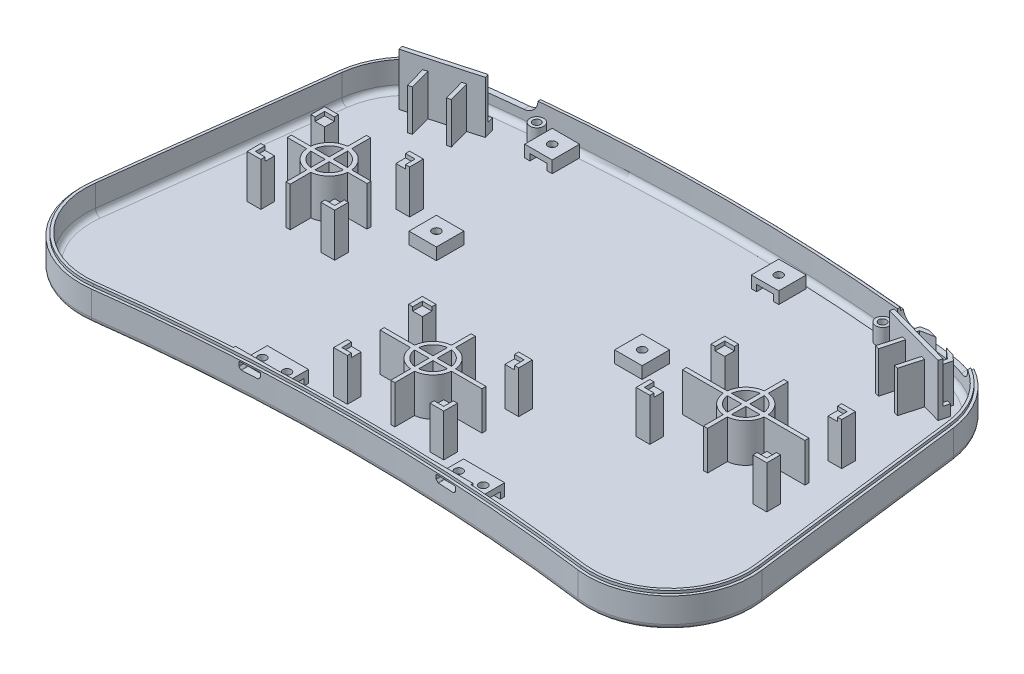
from build123d import *

# Parameters (mm, degrees)
FOND_COQUE_DEPTH               = 2
CONTOUR_COQUE_DEPTH            = 10
CONG_1_R                       = 2
CONG_2_R                       = 2
GLISSI_RES_ARDUINO_DUE_DEPTH   = 2.35
ESQUISSE_SUPPORT_ARDUINO_DUE_W = 10
ESQUISSE_SUPPORT_ARDUINO_DUE_H = 10
ESQUISSE_SUPPORT_ARDUINO_DUE_R = 1.5
SUPPORT_ARDUINO_DUE_DEPTH      = 2
ENTR_E_USB_NATIVE_REACH        = 144.927
GLISSI_RES_USB_NATIVE_DEPTH    = 2.35
ESQUISSE_SUPPORT_USB_NATIVE_R  = 1.5
SUPPORT_USB_NATIVE_DEPTH       = 2.05
BOSS_EXTRU_4_DEPTH             = 5.6
COINS_DPAD_DEPTH               = 15.8
ESQUISSE_INT_RIEUR_DPAD_W      = 3.5
ESQUISSE_INT_RIEUR_DPAD_H      = 3.5
INT_RIEUR_DPAD_DEPTH           = 14.4
ESQUISSE_CERCLE_DPAD_R         = 7.5
ESQUISSE_CERCLE_DPAD_R_2       = 6
CERCLE_DPAD_DEPTH              = 14.4
COINS_ABXY_DEPTH               = 15.5
ESQUISSE_INT_RIEUR_ABXY_W      = 3.5
ESQUISSE_INT_RIEUR_ABXY_H      = 3.5
INT_RIEUR_ABXY_DEPTH           = 14.1
ESQUISSE_CERCLE_ABXY_R         = 7.5
ESQUISSE_CERCLE_ABXY_R_2       = 6
CERCLE_ABXY_DEPTH              = 14.1
BOSS_EXTRU_1_DEPTH             = 15.4
ESQUISSE2_W                    = 3.5
ESQUISSE2_H                    = 3.5
BOSS_EXTRU_2_DEPTH             = 14
ESQUISSE3_R                    = 7.5
ESQUISSE3_R_2                  = 6
BOSS_EXTRU_3_DEPTH             = 14
ENL_V_MAT_EXTRU_1_DEPTH        = 1
ENL_V_MAT_EXTRU_2_REACH        = 145.53
BOSS_EXTRU_10_DEPTH            = 2.35
ESQUISSE12_R                   = 1.5
BOSS_EXTRU_11_DEPTH            = 2.05
BOSS_EXTRU_12_DEPTH            = 5.6
ENL_V_MAT_EXTRU_3_DEPTH        = 1
ENL_V_MAT_EXTRU_5_DEPTH        = 12.5
ESQUISSE25_R                   = 2.5
ESQUISSE25_R_2                 = 1.4
BOSS_EXTRU_19_DEPTH            = 6.04
BOSS_EXTRU_20_DEPTH            = 14
BOSS_EXTRU_21_DEPTH            = 3.85
BOSS_EXTRU_22_DEPTH            = 4
BOSS_EXTRU_23_DEPTH            = 15
BOSS_EXTRU_24_DEPTH            = 15
BOSS_EXTRU_25_DEPTH            = 1
ENL_V_START                    = -1
ENL_V_MAT_EXTRU_6_DEPTH        = 1


with BuildPart() as part:
    # Esquisse fond coque → Fond coque (new body)
    with BuildSketch(Plane(origin=(0, 0, 0), x_dir=(1, 0, 0), z_dir=(0, 1, 0))):
        with BuildLine():
            Line((-122.267092617, -38.917464466), (-112.267092617, 40.866153364))
            ThreePointArc((-112.267092617, 40.866153364), (-103.730176239, 58.331392363), (-86.278625954, 66.896257055))
            ThreePointArc((-86.278625954, 66.896257055), (0, 72.351557493), (86.278625954, 66.896257055))
            ThreePointArc((86.278625954, 66.896257055), (103.730176239, 58.331392363), (112.267092617, 40.866153364))
            Line((112.267092617, 40.866153364), (122.267092617, -38.917464466))
            ThreePointArc((122.267092617, -38.917464466), (113.659620701, -63.915093672), (88.618881119, -72.396331781))
            ThreePointArc((88.618881119, -72.396331781), (0, -66.639803527), (-88.618881119, -72.396331781))
            ThreePointArc((-88.618881119, -72.396331781), (-113.659620701, -63.915093672), (-122.267092617, -38.917464466))
        make_face()
    extrude(amount=FOND_COQUE_DEPTH)

    # Esquisse contour coque → Contour coque (add)
    with BuildSketch(Plane(origin=(0, 2, 0), x_dir=(1, 0, 0), z_dir=(0, 1, 0))):
        with BuildLine():
            Line((-122.267092617, -38.917464466), (-112.267092617, 40.866153364))
            ThreePointArc((-112.267092617, 40.866153364), (-103.730176239, 58.331392363), (-86.278625954, 66.896257055))
            ThreePointArc((-86.278625954, 66.896257055), (0, 72.351557493), (86.278625954, 66.896257055))
            ThreePointArc((86.278625954, 66.896257055), (103.730176239, 58.331392363), (112.267092617, 40.866153364))
            Line((112.267092617, 40.866153364), (122.267092617, -38.917464466))
            ThreePointArc((122.267092617, -38.917464466), (113.659620701, -63.915093672), (88.618881119, -72.396331781))
            ThreePointArc((88.618881119, -72.396331781), (0, -66.639803527), (-88.618881119, -72.396331781))
            ThreePointArc((-88.618881119, -72.396331781), (-113.659620701, -63.915093672), (-122.267092617, -38.917464466))
        make_face()
        with BuildLine():
            Line((-120.282619776, -39.166196336), (-110.282619776, 40.617421494))
            ThreePointArc((-110.282619776, 40.617421494), (-102.314831157, 56.918311227), (-86.026717557, 64.91218494))
            ThreePointArc((-86.026717557, 64.91218494), (0, 70.351557493), (86.026717557, 64.91218494))
            ThreePointArc((86.026717557, 64.91218494), (102.314831157, 56.918311227), (110.282619776, 40.617421494))
            Line((110.282619776, 40.617421494), (120.282619776, -39.166196336))
            ThreePointArc((120.282619776, -39.166196336), (112.248979321, -62.497316928), (88.877622378, -70.413139163))
            ThreePointArc((88.877622378, -70.413139163), (0, -64.639803527), (-88.877622378, -70.413139163))
            ThreePointArc((-88.877622378, -70.413139163), (-112.248979321, -62.497316928), (-120.282619776, -39.166196336))
        make_face(mode=Mode.SUBTRACT)
    extrude(amount=CONTOUR_COQUE_DEPTH)

    # Congé1
    cong_1_edges = [part.edges().sort_by_distance(p)[0] for p in [
        (-115.282619776, 2, -0.725612579),
        (-102.314831157, 2, -56.918311227),
        (0, 2, -70.351557493),
        (102.314831157, 2, -56.918311227),
        (115.282619776, 2, -0.725612579),
        (112.248979321, 2, 62.497316928),
        (0, 2, 64.639803527),
        (-112.248979321, 2, 62.497316928),
    ]]
    fillet(cong_1_edges, radius=CONG_1_R)

    # Congé2
    cong_2_edges = [part.edges().sort_by_distance(p)[0] for p in [
        (0, 0, 66.639803527),
        (113.659620701, 0, 63.915093672),
        (117.267092617, 0, -0.974344449),
        (103.730176239, 0, -58.331392363),
        (0, 0, -72.351557493),
        (-103.730176239, 0, -58.331392363),
        (-117.267092617, 0, -0.974344449),
        (-113.659620701, 0, 63.915093672),
    ]]
    fillet(cong_2_edges, radius=CONG_2_R)

    # Esquisse glissières Arduino Due → Glissières Arduino Due (add)
    with BuildSketch(Plane(origin=(0, 2, 0), x_dir=(1, 0, 0), z_dir=(0, 1, 0))):
        Polygon((23.198146935, 13.360196473), (24.748146935, 10.675517722), (27.848146935, 10.675517722), (29.398146935, 13.360196473), (29.398146935, 18.360196473), (31.298146935, 18.360196473), (31.298146935, 8.360196473), (21.298146935, 8.360196473), (21.298146935, 18.360196473), (23.198146935, 18.360196473), align=None)
        Polygon((-51.731853065, 13.360196473), (-50.181853065, 10.675517722), (-47.081853065, 10.675517722), (-45.531853065, 13.360196473), (-45.531853065, 18.360196473), (-43.631853065, 18.360196473), (-43.631853065, 8.360196473), (-53.631853065, 8.360196473), (-53.631853065, 18.360196473), (-51.731853065, 18.360196473), align=None)
        Polygon((-51.881853065, 61.880196473), (-53.431853065, 64.564875225), (-56.531853065, 64.564875225), (-58.081853065, 61.880196473), (-58.081853065, 56.880196473), (-59.981853065, 56.880196473), (-59.981853065, 66.880196473), (-49.981853065, 66.880196473), (-49.981853065, 56.880196473), (-51.881853065, 56.880196473), align=None)
        Polygon((30.668146935, 61.880196473), (29.118146935, 64.564875225), (26.018146935, 64.564875225), (24.468146935, 61.880196473), (24.468146935, 56.880196473), (22.568146935, 56.880196473), (22.568146935, 66.880196473), (32.568146935, 66.880196473), (32.568146935, 56.880196473), (30.668146935, 56.880196473), align=None)
    extrude(amount=GLISSI_RES_ARDUINO_DUE_DEPTH)

    # Esquisse support Arduino Due → Support Arduino Due (add)
    # profile 1 of 4: a face of its own
    with BuildSketch(Plane(origin=(0, 4.35, 0), x_dir=(1, 0, 0), z_dir=(0, 1, 0))):
        with Locations((-54.981853065, 61.880196473)):
            Rectangle(ESQUISSE_SUPPORT_ARDUINO_DUE_W, ESQUISSE_SUPPORT_ARDUINO_DUE_H)
        with Locations((-54.981853065, 61.880196473)):
            Circle(ESQUISSE_SUPPORT_ARDUINO_DUE_R, mode=Mode.SUBTRACT)
    # profile 2 of 4: a face of its own
    with BuildSketch(Plane(origin=(0, 4.35, 0), x_dir=(1, 0, 0), z_dir=(0, 1, 0))):
        with Locations((27.568146935, 61.880196473)):
            Rectangle(ESQUISSE_SUPPORT_ARDUINO_DUE_W, ESQUISSE_SUPPORT_ARDUINO_DUE_H)
        with Locations((27.568146935, 61.880196473)):
            Circle(ESQUISSE_SUPPORT_ARDUINO_DUE_R, mode=Mode.SUBTRACT)
    # profile 3 of 4: a face of its own
    with BuildSketch(Plane(origin=(0, 4.35, 0), x_dir=(1, 0, 0), z_dir=(0, 1, 0))):
        with Locations((26.298146935, 13.360196473)):
            Rectangle(ESQUISSE_SUPPORT_ARDUINO_DUE_W, ESQUISSE_SUPPORT_ARDUINO_DUE_H)
        with Locations((26.298146935, 13.360196473)):
            Circle(ESQUISSE_SUPPORT_ARDUINO_DUE_R, mode=Mode.SUBTRACT)
    # profile 4 of 4: a face of its own
    with BuildSketch(Plane(origin=(0, 4.35, 0), x_dir=(1, 0, 0), z_dir=(0, 1, 0))):
        with Locations((-48.631853065, 13.360196473)):
            Rectangle(ESQUISSE_SUPPORT_ARDUINO_DUE_W, ESQUISSE_SUPPORT_ARDUINO_DUE_H)
        with Locations((-48.631853065, 13.360196473)):
            Circle(ESQUISSE_SUPPORT_ARDUINO_DUE_R, mode=Mode.SUBTRACT)
    extrude(amount=SUPPORT_ARDUINO_DUE_DEPTH)

    # Esquisse entrée USB Native → Entrée USB Native (cut, up to next)
    with BuildSketch(Plane.XY, mode=Mode.PRIVATE) as entr_e_usb_native_sk1:
        with BuildLine():
            Line((32.925, 8), (38.575, 8))
            ThreePointArc((38.575, 8), (38.689248248, 8.022606168), (38.786278395, 8.087017747))
            Line((38.786278395, 8.087017747), (39.411278395, 8.707017747))
            ThreePointArc((39.411278395, 8.707017747), (39.47693277, 8.804638651), (39.5, 8.92))
            Line((39.5, 8.92), (39.5, 10.15))
            ThreePointArc((39.5, 10.15), (39.412132034, 10.362132034), (39.2, 10.45))
            Line((39.2, 10.45), (32.3, 10.45))
            ThreePointArc((32.3, 10.45), (32.087867966, 10.362132034), (32, 10.15))
            Line((32, 10.15), (32, 8.92))
            ThreePointArc((32, 8.92), (32.02306723, 8.804638651), (32.088721605, 8.707017747))
            Line((32.088721605, 8.707017747), (32.713721605, 8.087017747))
            ThreePointArc((32.713721605, 8.087017747), (32.810751752, 8.022606168), (32.925, 8))
        make_face()
    entr_e_usb_native_tool1 = extrude(entr_e_usb_native_sk1.sketch, amount=ENTR_E_USB_NATIVE_REACH, mode=Mode.PRIVATE) & part.part
    add(entr_e_usb_native_tool1.solids().sort_by_distance((35.75, 9.2574, 0))[0], mode=Mode.SUBTRACT)

    # Esquisse glissières USB Native → Glissières USB Native (add)
    with BuildSketch(Plane(origin=(0, 2, 0), x_dir=(1, 0, 0), z_dir=(0, 1, 0))):
        with BuildLine():
            Line((28.250303077, -53.642573438), (28.250303077, -55.240893257))
            Line((28.250303077, -55.240893257), (31.175303077, -55.240893257))
            Line((31.175303077, -55.240893257), (33.859981829, -56.790893257))
            Line((33.859981829, -56.790893257), (33.859981829, -59.890893257))
            Line((33.859981829, -59.890893257), (31.175303077, -61.440893257))
            Line((31.175303077, -61.440893257), (28.250303077, -61.440893257))
            Line((28.250303077, -61.440893257), (28.250303077, -65.220893257))
            ThreePointArc((28.250303077, -65.220893257), (35.752439442, -65.570737708), (43.250303077, -66.002573438))
            Line((43.250303077, -66.002573438), (43.250303077, -61.440893257))
            Line((43.250303077, -61.440893257), (40.125303077, -61.440893257))
            Line((40.125303077, -61.440893257), (37.440624325, -59.890893257))
            Line((37.440624325, -59.890893257), (37.440624325, -56.790893257))
            Line((37.440624325, -56.790893257), (40.125303077, -55.240893257))
            Line((40.125303077, -55.240893257), (43.250303077, -55.240893257))
            Line((43.250303077, -55.240893257), (43.250303077, -53.642573438))
            Line((43.250303077, -53.642573438), (28.250303077, -53.642573438))
        make_face()
    extrude(amount=GLISSI_RES_USB_NATIVE_DEPTH)

    # Esquisse support USB Native → Support USB Native (add)
    with BuildSketch(Plane(origin=(0, 4.35, 0), x_dir=(1, 0, 0), z_dir=(0, 1, 0))):
        with BuildLine():
            Line((28.250303077, -53.642573438), (43.250303077, -53.642573438))
            Line((43.250303077, -53.642573438), (43.250303077, -66.002573438))
            ThreePointArc((43.250303077, -66.002573438), (35.752439442, -65.570737708), (28.250303077, -65.220893257))
            Line((28.250303077, -65.220893257), (28.250303077, -53.642573438))
        make_face()
        with Locations((31.175303077, -58.340893257)):
            Circle(ESQUISSE_SUPPORT_USB_NATIVE_R, mode=Mode.SUBTRACT)
        with Locations((40.125303077, -58.340893257)):
            Circle(ESQUISSE_SUPPORT_USB_NATIVE_R, mode=Mode.SUBTRACT)
    extrude(amount=SUPPORT_USB_NATIVE_DEPTH)

    # Esquisse4 → Boss.-Extru.4 (add)
    with BuildSketch(Plane(origin=(0, 6.4, 0), x_dir=(1, 0, 0), z_dir=(0, 1, 0))):
        with BuildLine():
            Line((28.250303077, -65.220893257), (43.250303077, -65.220893257))
            Line((43.250303077, -65.220893257), (43.250303077, -66.002573438))
            ThreePointArc((43.250303077, -66.002573438), (35.752439442, -65.570737708), (28.250303077, -65.220893257))
        make_face()
    extrude(amount=BOSS_EXTRU_4_DEPTH)

    # Esquisse coins DPad → Coins DPad (add)
    with BuildSketch(Plane(origin=(0, 2, 0), x_dir=(1, 0, 0), z_dir=(0, 1, 0))):
        Polygon((-95.298146935, 15.820053456), (-95.298146935, 19.320053456), (-91.798146935, 19.320053456), (-91.798146935, 20.820053456), (-96.798146935, 20.820053456), (-96.798146935, 15.820053456), align=None)
        Polygon((-96.798146935, -2.429946544), (-95.298146935, -2.429946544), (-95.298146935, -5.929946544), (-91.798146935, -5.929946544), (-91.798146935, -7.429946544), (-96.798146935, -7.429946544), align=None)
        Polygon((-62.298146935, -10.029946544), (-67.298146935, -10.029946544), (-67.298146935, -8.529946544), (-63.798146935, -8.529946544), (-63.798146935, -5.029946544), (-62.298146935, -5.029946544), align=None)
        Polygon((-62.298146935, 22.270053456), (-67.298146935, 22.270053456), (-67.298146935, 20.770053456), (-63.798146935, 20.770053456), (-63.798146935, 17.270053456), (-62.298146935, 17.270053456), align=None)
    extrude(amount=COINS_DPAD_DEPTH)

    # Esquisse intérieur DPad → Intérieur DPad (add)
    with BuildSketch(Plane(origin=(0, 2, 0), x_dir=(1, 0, 0), z_dir=(0, 1, 0))):
        with Locations((-93.548146935, 17.570053456)):
            Rectangle(ESQUISSE_INT_RIEUR_DPAD_W, ESQUISSE_INT_RIEUR_DPAD_H)
        with Locations((-65.548146935, 19.020053456)):
            Rectangle(ESQUISSE_INT_RIEUR_DPAD_W, ESQUISSE_INT_RIEUR_DPAD_H)
        with Locations((-93.548146935, -4.179946544)):
            Rectangle(ESQUISSE_INT_RIEUR_DPAD_W, ESQUISSE_INT_RIEUR_DPAD_H)
        with Locations((-65.548146935, -6.779946544)):
            Rectangle(ESQUISSE_INT_RIEUR_DPAD_W, ESQUISSE_INT_RIEUR_DPAD_H)
        Polygon((-80.021636454, 5.686268005), (-66.245125973, 5.686268005), (-66.245125973, 7.186268005), (-80.021636454, 7.186268005), (-80.021636454, 20.770053456), (-81.521636454, 20.770053456), (-81.521636454, 7.186268005), (-95.298146935, 7.186268005), (-95.298146935, 5.686268005), (-81.521636454, 5.686268005), (-81.521636454, -8.529946544), (-80.021636454, -8.529946544), align=None)
    extrude(amount=INT_RIEUR_DPAD_DEPTH)

    # Esquisse cercle DPad → Cercle DPad (add)
    with BuildSketch(Plane(origin=(0, 2, 0), x_dir=(1, 0, 0), z_dir=(0, 1, 0))):
        with Locations((-80.771636454, 6.436268005)):
            Circle(ESQUISSE_CERCLE_DPAD_R)
        with Locations((-80.771636454, 6.436268005)):
            Circle(ESQUISSE_CERCLE_DPAD_R_2, mode=Mode.SUBTRACT)
    extrude(amount=CERCLE_DPAD_DEPTH)

    # Esquisse coins ABXY → Coins ABXY (add)
    with BuildSketch(Plane(origin=(0, 2, 0), x_dir=(1, 0, 0), z_dir=(0, 1, 0))):
        Polygon((48.198146935, 16.585053456), (49.698146935, 16.585053456), (49.698146935, 20.085053456), (53.198146935, 20.085053456), (53.198146935, 21.585053456), (48.198146935, 21.585053456), align=None)
        Polygon((94.298146935, 16.585053456), (95.798146935, 16.585053456), (95.798146935, 21.585053456), (90.798146935, 21.585053456), (90.798146935, 20.085053456), (94.298146935, 20.085053456), align=None)
        Polygon((49.698146935, -5.714946544), (48.198146935, -5.714946544), (48.198146935, -10.714946544), (53.198146935, -10.714946544), (53.198146935, -9.214946544), (49.698146935, -9.214946544), align=None)
        Polygon((94.298146935, -5.714946544), (95.798146935, -5.714946544), (95.798146935, -10.714946544), (90.798146935, -10.714946544), (90.798146935, -9.214946544), (94.298146935, -9.214946544), align=None)
    extrude(amount=COINS_ABXY_DEPTH)

    # Esquisse intérieur ABXY → Intérieur ABXY (add)
    with BuildSketch(Plane(origin=(0, 2, 0), x_dir=(1, 0, 0), z_dir=(0, 1, 0))):
        with Locations((51.448146935, 18.335053456)):
            Rectangle(ESQUISSE_INT_RIEUR_ABXY_W, ESQUISSE_INT_RIEUR_ABXY_H)
        with Locations((92.548146935, 18.335053456)):
            Rectangle(ESQUISSE_INT_RIEUR_ABXY_W, ESQUISSE_INT_RIEUR_ABXY_H)
        with Locations((51.448146935, -7.464946544)):
            Rectangle(ESQUISSE_INT_RIEUR_ABXY_W, ESQUISSE_INT_RIEUR_ABXY_H)
        with Locations((92.548146935, -7.464946544)):
            Rectangle(ESQUISSE_INT_RIEUR_ABXY_W, ESQUISSE_INT_RIEUR_ABXY_H)
        Polygon((72.748146935, 4.685053456), (94.298146935, 4.685053456), (94.298146935, 6.185053456), (72.748146935, 6.185053456), (72.748146935, 20.085053456), (71.248146935, 20.085053456), (71.248146935, 6.185053456), (49.698146935, 6.185053456), (49.698146935, 4.685053456), (71.248146935, 4.685053456), (71.248146935, -9.214946544), (72.748146935, -9.214946544), align=None)
    extrude(amount=INT_RIEUR_ABXY_DEPTH)

    # Esquisse cercle ABXY → Cercle ABXY (add)
    with BuildSketch(Plane(origin=(0, 2, 0), x_dir=(1, 0, 0), z_dir=(0, 1, 0))):
        with Locations((71.998146935, 5.435053456)):
            Circle(ESQUISSE_CERCLE_ABXY_R)
        with Locations((71.998146935, 5.435053456)):
            Circle(ESQUISSE_CERCLE_ABXY_R_2, mode=Mode.SUBTRACT)
    extrude(amount=CERCLE_ABXY_DEPTH)

    # Esquisse1 → Boss.-Extru.1 (add)
    with BuildSketch(Plane(origin=(0, 2, 0), x_dir=(1, 0, 0), z_dir=(0, 1, 0))):
        Polygon((-19.55, -20.85), (-14.55, -20.85), (-14.55, -22.35), (-18.05, -22.35), (-18.05, -25.85), (-19.55, -25.85), align=None)
        Polygon((15.55, -20.85), (20.55, -20.85), (20.55, -25.85), (19.05, -25.85), (19.05, -22.35), (15.55, -22.35), align=None)
        Polygon((-19.55, -53.15), (-14.55, -53.15), (-14.55, -51.65), (-18.05, -51.65), (-18.05, -48.15), (-19.55, -48.15), align=None)
        Polygon((20.55, -53.15), (15.55, -53.15), (15.55, -51.65), (19.05, -51.65), (19.05, -48.15), (20.55, -48.15), align=None)
    extrude(amount=BOSS_EXTRU_1_DEPTH)

    # Esquisse2 → Boss.-Extru.2 (add)
    with BuildSketch(Plane(origin=(0, 2, 0), x_dir=(1, 0, 0), z_dir=(0, 1, 0))):
        with Locations((-16.3, -24.1)):
            Rectangle(ESQUISSE2_W, ESQUISSE2_H)
        with Locations((-16.3, -49.9)):
            Rectangle(ESQUISSE2_W, ESQUISSE2_H)
        with Locations((17.3, -24.1)):
            Rectangle(ESQUISSE2_W, ESQUISSE2_H)
        with Locations((17.3, -49.9)):
            Rectangle(ESQUISSE2_W, ESQUISSE2_H)
        Polygon((-0.25, -36.25), (-0.25, -22.35), (1.25, -22.35), (1.25, -36.25), (19.05, -36.25), (19.05, -37.75), (1.25, -37.75), (1.25, -51.65), (-0.25, -51.65), (-0.25, -37.75), (-18.05, -37.75), (-18.05, -36.25), align=None)
    extrude(amount=BOSS_EXTRU_2_DEPTH)

    # Esquisse3 → Boss.-Extru.3 (add)
    with BuildSketch(Plane(origin=(0, 2, 0), x_dir=(1, 0, 0), z_dir=(0, 1, 0))):
        with Locations((0.5, -37)):
            Circle(ESQUISSE3_R)
        with Locations((0.5, -37)):
            Circle(ESQUISSE3_R_2, mode=Mode.SUBTRACT)
    extrude(amount=BOSS_EXTRU_3_DEPTH)

    # Esquisse5 → Enlèv. mat.-Extru.1 (cut, symmetric)
    with BuildSketch(Plane.XY.offset(65.579036278)):
        with BuildLine():
            Line((32.3, 10.45), (39.2, 10.45))
            ThreePointArc((39.2, 10.45), (39.412132034, 10.362132034), (39.5, 10.15))
            Line((39.5, 10.15), (39.5, 8.92))
            ThreePointArc((39.5, 8.92), (39.47693277, 8.804638651), (39.411278395, 8.707017747))
            Line((39.411278395, 8.707017747), (38.786278395, 8.087017747))
            ThreePointArc((38.786278395, 8.087017747), (38.689248248, 8.022606168), (38.575, 8))
            Line((38.575, 8), (32.925, 8))
            ThreePointArc((32.925, 8), (32.810751752, 8.022606168), (32.713721605, 8.087017747))
            Line((32.713721605, 8.087017747), (32.088721605, 8.707017747))
            ThreePointArc((32.088721605, 8.707017747), (32.02306723, 8.804638651), (32, 8.92))
            Line((32, 8.92), (32, 10.15))
            ThreePointArc((32, 10.15), (32.087867966, 10.362132034), (32.3, 10.45))
        make_face()
    extrude(amount=ENL_V_MAT_EXTRU_1_DEPTH, both=True, mode=Mode.SUBTRACT)

    # Esquisse6 → Enlèv. mat.-Extru.2 (cut, up to next)
    with BuildSketch(Plane.XY, mode=Mode.PRIVATE) as enl_v_mat_extru_2_sk1:
        with BuildLine():
            Line((-38.575, 8), (-32.925, 8))
            ThreePointArc((-32.925, 8), (-32.810751752, 8.022606168), (-32.713721605, 8.087017747))
            Line((-32.713721605, 8.087017747), (-32.088721605, 8.707017747))
            ThreePointArc((-32.088721605, 8.707017747), (-32.02306723, 8.804638651), (-32, 8.92))
            Line((-32, 8.92), (-32, 10.15))
            ThreePointArc((-32, 10.15), (-32.087867966, 10.362132034), (-32.3, 10.45))
            Line((-32.3, 10.45), (-39.2, 10.45))
            ThreePointArc((-39.2, 10.45), (-39.412132034, 10.362132034), (-39.5, 10.15))
            Line((-39.5, 10.15), (-39.5, 8.92))
            ThreePointArc((-39.5, 8.92), (-39.47693277, 8.804638651), (-39.411278395, 8.707017747))
            Line((-39.411278395, 8.707017747), (-38.786278395, 8.087017747))
            ThreePointArc((-38.786278395, 8.087017747), (-38.689248248, 8.022606168), (-38.575, 8))
        make_face()
    enl_v_mat_extru_2_tool1 = extrude(enl_v_mat_extru_2_sk1.sketch, amount=ENL_V_MAT_EXTRU_2_REACH, mode=Mode.PRIVATE) & part.part
    add(enl_v_mat_extru_2_tool1.solids().sort_by_distance((-35.75, 9.2574, 0))[0], mode=Mode.SUBTRACT)

    # Esquisse11 → Boss.-Extru.10 (add)
    with BuildSketch(Plane(origin=(0, 2, 0), x_dir=(1, 0, 0), z_dir=(0, 1, 0))):
        with BuildLine():
            Line((-43.250303077, -66.002573438), (-43.250303077, -61.440893257))
            Line((-43.250303077, -61.440893257), (-40.325303077, -61.440893257))
            Line((-40.325303077, -61.440893257), (-37.640624325, -59.890893257))
            Line((-37.640624325, -59.890893257), (-37.640624325, -56.790893257))
            Line((-37.640624325, -56.790893257), (-40.325303077, -55.240893257))
            Line((-40.325303077, -55.240893257), (-43.250303077, -55.240893257))
            Line((-43.250303077, -55.240893257), (-43.250303077, -53.642573438))
            Line((-43.250303077, -53.642573438), (-28.250303077, -53.642573438))
            Line((-28.250303077, -53.642573438), (-28.250303077, -55.240893257))
            Line((-28.250303077, -55.240893257), (-31.375303077, -55.240893257))
            Line((-31.375303077, -55.240893257), (-34.059981829, -56.790893257))
            Line((-34.059981829, -56.790893257), (-34.059981829, -59.890893257))
            Line((-34.059981829, -59.890893257), (-31.375303077, -61.440893257))
            Line((-31.375303077, -61.440893257), (-28.250303077, -61.440893257))
            Line((-28.250303077, -61.440893257), (-28.250303077, -65.220893257))
            ThreePointArc((-28.250303077, -65.220893257), (-35.752439442, -65.570737708), (-43.250303077, -66.002573438))
        make_face()
    extrude(amount=BOSS_EXTRU_10_DEPTH)

    # Esquisse12 → Boss.-Extru.11 (add)
    with BuildSketch(Plane(origin=(0, 4.35, 0), x_dir=(1, 0, 0), z_dir=(0, 1, 0))):
        with BuildLine():
            Line((-28.250303077, -53.642573438), (-43.250303077, -53.642573438))
            Line((-43.250303077, -53.642573438), (-43.250303077, -66.002573438))
            ThreePointArc((-43.250303077, -66.002573438), (-35.752439442, -65.570737708), (-28.250303077, -65.220893257))
            Line((-28.250303077, -65.220893257), (-28.250303077, -53.642573438))
        make_face()
        with Locations((-40.325303077, -58.340893257)):
            Circle(ESQUISSE12_R, mode=Mode.SUBTRACT)
        with Locations((-31.375303077, -58.340893257)):
            Circle(ESQUISSE12_R, mode=Mode.SUBTRACT)
    extrude(amount=BOSS_EXTRU_11_DEPTH)

    # Esquisse13 → Boss.-Extru.12 (add)
    with BuildSketch(Plane(origin=(0, 6.4, 0), x_dir=(1, 0, 0), z_dir=(0, 1, 0))):
        with BuildLine():
            Line((-28.250303077, -65.220893257), (-43.250303077, -65.220893257))
            Line((-43.250303077, -65.220893257), (-43.250303077, -66.002573438))
            ThreePointArc((-43.250303077, -66.002573438), (-35.752439442, -65.570737708), (-28.250303077, -65.220893257))
        make_face()
    extrude(amount=BOSS_EXTRU_12_DEPTH)

    # Esquisse15 → Enlèv. mat.-Extru.3 (cut, symmetric)
    with BuildSketch(Plane.XY.offset(65.620024529)):
        with BuildLine():
            Line((-39.2, 10.45), (-32.3, 10.45))
            ThreePointArc((-32.3, 10.45), (-32.087867966, 10.362132034), (-32, 10.15))
            Line((-32, 10.15), (-32, 8.92))
            ThreePointArc((-32, 8.92), (-32.02306723, 8.804638651), (-32.088721605, 8.707017747))
            Line((-32.088721605, 8.707017747), (-32.713721605, 8.087017747))
            ThreePointArc((-32.713721605, 8.087017747), (-32.810751752, 8.022606168), (-32.925, 8))
            Line((-32.925, 8), (-38.575, 8))
            ThreePointArc((-38.575, 8), (-38.689248248, 8.022606168), (-38.786278395, 8.087017747))
            Line((-38.786278395, 8.087017747), (-39.411278395, 8.707017747))
            ThreePointArc((-39.411278395, 8.707017747), (-39.47693277, 8.804638651), (-39.5, 8.92))
            Line((-39.5, 8.92), (-39.5, 10.15))
            ThreePointArc((-39.5, 10.15), (-39.412132034, 10.362132034), (-39.2, 10.45))
        make_face()
    extrude(amount=ENL_V_MAT_EXTRU_3_DEPTH, both=True, mode=Mode.SUBTRACT)

    # Esquisse24 → Enlèv. mat.-Extru.5 (cut, symmetric)
    with BuildSketch(Plane(origin=(0, 0, -67.820792287), x_dir=(-1, 0, 0), z_dir=(0, 0, -1))):
        with BuildLine():
            Line((-92.85, 7.35), (-70.15, 7.35))
            ThreePointArc((-70.15, 7.35), (-66.861953467, 8.711953467), (-65.5, 12))
            Line((-65.5, 12), (-97.5, 12))
            ThreePointArc((-97.5, 12), (-96.138046533, 8.711953467), (-92.85, 7.35))
        make_face()
        with BuildLine():
            Line((97.5, 12), (65.5, 12))
            ThreePointArc((65.5, 12), (66.861953467, 8.711953467), (70.15, 7.35))
            Line((70.15, 7.35), (92.85, 7.35))
            ThreePointArc((92.85, 7.35), (96.138046533, 8.711953467), (97.5, 12))
        make_face()
    extrude(amount=ENL_V_MAT_EXTRU_5_DEPTH, both=True, mode=Mode.SUBTRACT)

    # Esquisse25 → Boss.-Extru.19 (add)
    # profile 1 of 2: a face of its own
    with BuildSketch(Plane(origin=(0, 2, 0), x_dir=(1, 0, 0), z_dir=(0, 1, 0))):
        with Locations((-62.98, 64.303563447)):
            Circle(ESQUISSE25_R)
        with Locations((-62.98, 64.303563447)):
            Circle(ESQUISSE25_R_2, mode=Mode.SUBTRACT)
    # profile 2 of 2: a face of its own
    with BuildSketch(Plane(origin=(0, 2, 0), x_dir=(1, 0, 0), z_dir=(0, 1, 0))):
        with Locations((62.98, 64.303563447)):
            Circle(ESQUISSE25_R)
        with Locations((62.98, 64.303563447)):
            Circle(ESQUISSE25_R_2, mode=Mode.SUBTRACT)
    extrude(amount=BOSS_EXTRU_19_DEPTH)

    # Esquisse26 → Boss.-Extru.20 (add)
    with BuildSketch(Plane(origin=(0, 2, 0), x_dir=(1, 0, 0), z_dir=(0, 1, 0))):
        Polygon((-91.596460031, 54.44630382), (-95.161452938, 53.455937436), (-96.133440015, 56.95477089), (-94.385992601, 58.231347833), (-90.556402881, 59.295220055), (-94.438885337, 56.458918632), (-94.090918769, 55.206353556), (-91.971193257, 55.795220055), align=None)
        Polygon((-85.2570891, 60.767386301), (-81.42749938, 61.831258523), (-79.271987077, 61.63893622), (-78.3, 58.140102765), (-81.864992907, 57.149736382), (-82.239726133, 58.498652617), (-80.120000621, 59.087519115), (-80.467967188, 60.34008419), align=None)
        Polygon((81.864992907, 57.149736382), (78.3, 58.140102765), (79.273324223, 61.643749504), (82.102030101, 62.16945081), (85.392635871, 61.255310046), (80.467967188, 60.34008419), (80.120000621, 59.087519115), (82.239726133, 58.498652617), align=None)
        Polygon((90.691949651, 59.7831438), (93.982555421, 58.869003037), (96.134777161, 56.959584174), (95.161452938, 53.455937436), (91.596460031, 54.44630382), (91.971193257, 55.795220055), (94.090918769, 55.206353556), (94.438885337, 56.458918632), align=None)
    extrude(amount=BOSS_EXTRU_20_DEPTH)

    # Esquisse27 → Boss.-Extru.21 (add)
    with BuildSketch(Plane(origin=(0, 2, 0), x_dir=(1, 0, 0), z_dir=(0, 1, 0))):
        Polygon((-89.75347655, 59.518275547), (-88.577457029, 55.284992469), (-87.132189634, 55.686492355), (-88.308209156, 59.919775432), align=None)
        Polygon((-87.505282825, 60.142830924), (-86.329263304, 55.909547847), (-84.883995909, 56.311047732), (-86.060015431, 60.544330809), align=None)
        Polygon((84.883995909, 56.311047732), (86.195562201, 61.032254555), (87.640829596, 60.630754669), (86.329263304, 55.909547847), align=None)
        Polygon((87.132189634, 55.686492355), (88.577457029, 55.284992469), (89.889023321, 60.006199292), (88.443755926, 60.407699177), align=None)
    extrude(amount=BOSS_EXTRU_21_DEPTH)

    # Esquisse31 → Boss.-Extru.22 (add)
    with BuildSketch(Plane(origin=(0, 2, 0), x_dir=(1, 0, 0), z_dir=(0, 1, 0))):
        Polygon((75.436187805, 57.171299527), (97.115198725, 51.148801246), (97.704065224, 53.268526759), (99.149332618, 52.867026873), (98.158966234, 49.302033966), (73.589420525, 56.127532018), (74.579786909, 59.692524925), (76.025054304, 59.291025039), align=None)
        Polygon((-97.704065224, 53.268526759), (-97.115198725, 51.148801246), (-75.436187805, 57.171299527), (-76.025054304, 59.291025039), (-74.579786909, 59.692524925), (-73.589420525, 56.127532018), (-98.158966234, 49.302033966), (-99.149332618, 52.867026873), align=None)
    extrude(amount=BOSS_EXTRU_22_DEPTH)

    # Esquisse32 → Boss.-Extru.23 (add)
    with BuildSketch(Plane(origin=(0, 6, 0), x_dir=(1, 0, 0), z_dir=(0, 1, 0))):
        Polygon((73.589420525, 56.127532018), (98.158966234, 49.302033966), (98.56046612, 50.747301361), (73.990920411, 57.572799413), align=None)
        Polygon((-98.158966234, 49.302033966), (-73.589420525, 56.127532018), (-73.990920411, 57.572799413), (-98.56046612, 50.747301361), align=None)
    extrude(amount=BOSS_EXTRU_23_DEPTH)

    # Esquisse33 → Boss.-Extru.24 (add)
    with BuildSketch(Plane(origin=(0, 2, 0), x_dir=(1, 0, 0), z_dir=(0, 1, 0))):
        Polygon((80.3340017, 54.253865886), (78.192668978, 46.545773115), (79.637936373, 46.144273229), (81.779269095, 53.852366001), align=None)
        Polygon((89.969117665, 51.577199984), (87.827784943, 43.869107212), (89.273052337, 43.467607327), (91.414385059, 51.175700098), align=None)
        Polygon((-87.827784943, 43.869107212), (-89.969117665, 51.577199984), (-91.414385059, 51.175700098), (-89.273052337, 43.467607327), align=None)
        Polygon((-80.3340017, 54.253865886), (-78.888734306, 54.655365771), (-76.747401584, 46.947273), (-78.192668978, 46.545773115), align=None)
    extrude(amount=BOSS_EXTRU_24_DEPTH)

    # Esquisse34 → Boss.-Extru.25 (add)
    with BuildSketch(Plane(origin=(0, 2, 0), x_dir=(1, 0, 0), z_dir=(0, 1, 0))):
        Polygon((-97.115198725, 51.148801246), (-75.436187805, 57.171299527), (-75.891221009, 58.809269241), (-97.570231929, 52.78677096), align=None)
        Polygon((75.436187805, 57.171299527), (97.115198725, 51.148801246), (97.570231929, 52.78677096), (75.891221009, 58.809269241), align=None)
    extrude(amount=BOSS_EXTRU_25_DEPTH)

    # Esquisse35 → Enlèv. mat.-Extru.6 (cut)
    with BuildSketch(Plane(origin=(0, 12, 0), x_dir=(1, 0, 0), z_dir=(0, 1, 0)).offset(ENL_V_START)):
        with BuildLine():
            Line((-111.268592936, 40.741002398), (-121.268592936, -39.042615432))
            ThreePointArc((-121.268592936, -39.042615432), (-112.94984784, -63.201730608), (-88.74906837, -71.398476253))
            ThreePointArc((-88.74906837, -71.398476253), (0, -65.633491261), (88.74906837, -71.398476253))
            ThreePointArc((88.74906837, -71.398476253), (112.94984784, -63.201730608), (121.268592936, -39.042615432))
            Line((121.268592936, -39.042615432), (111.268592936, 40.741002398))
            ThreePointArc((111.268592936, 40.741002398), (106.690199187, 53.118547673), (97.1, 62.184605025))
            Line((97.1, 62.184605025), (97.1, 63.342807798))
            ThreePointArc((97.1, 63.342807798), (107.367845211, 53.915827114), (112.267092617, 40.866153364))
            Line((112.267092617, 40.866153364), (122.267092617, -38.917464466))
            ThreePointArc((122.267092617, -38.917464466), (113.659620701, -63.915093672), (88.618881119, -72.396331781))
            ThreePointArc((88.618881119, -72.396331781), (0, -66.639803527), (-88.618881119, -72.396331781))
            ThreePointArc((-88.618881119, -72.396331781), (-113.659620701, -63.915093672), (-122.267092617, -38.917464466))
            Line((-122.267092617, -38.917464466), (-112.267092617, 40.866153364))
            ThreePointArc((-112.267092617, 40.866153364), (-107.368021249, 53.915566235), (-97.100549863, 63.342501468))
            Line((-97.100549863, 63.342501468), (-97.100549863, 62.184284531))
            ThreePointArc((-97.100549863, 62.184284531), (-106.690374614, 53.11828217), (-111.268592936, 40.741002398))
        make_face()
        with BuildLine():
            Line((-65.9, 69.174254387), (-65.9, 68.169580715))
            ThreePointArc((-65.9, 68.169580715), (0, 71.351550727), (65.9, 68.169580715))
            Line((65.9, 68.169580715), (65.9, 69.174254387))
            ThreePointArc((65.9, 69.174254387), (0, 72.351557493), (-65.9, 69.174254387))
        make_face()
    extrude(amount=ENL_V_MAT_EXTRU_6_DEPTH, mode=Mode.SUBTRACT)


solid = part.part
